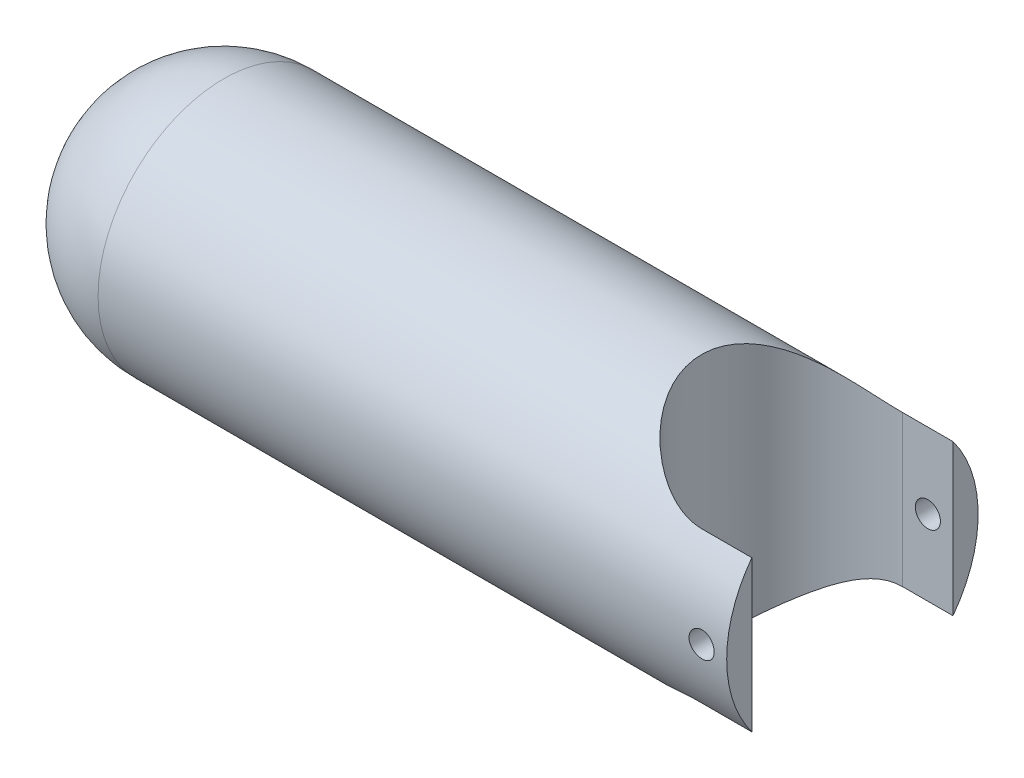
from build123d import *

# Parameters (mm, degrees)
CORTAR_EXTRUIR1_DEPTH      = 166.73304219
CORTAR_EXTRUIR1_DEPTH_BACK = 166.73304219
CROQUIS6_R                 = 2.5
CORTAR_EXTRUIR3_DEPTH      = 166.733042318
CORTAR_EXTRUIR3_DEPTH_BACK = 166.733042318


with BuildPart() as part:
    # Croquis3 → Revolución10 (revolve)
    with BuildSketch(Plane(origin=(0, 0, 0), x_dir=(1, 0, 0), z_dir=(0, 1, 0))):
        with BuildLine():
            Line((11.918007873, 0), (161.918007873, 0))
            Line((161.918007873, 0), (161.918007873, 25))
            Line((161.918007873, 25), (36.918007873, 25))
            ThreePointArc((36.918007873, 25), (19.240338344, 17.67766953), (11.918007873, 0))
        make_face()
    revolve(axis=Axis((11.918007873, 0, 0), (1, 0, 0)))

    # Croquis6 → Cortar-Extruir1 (cut, two sides: drawn at the far end of the back side and taken through both)
    with BuildSketch(Plane.XY.offset(-CORTAR_EXTRUIR1_DEPTH_BACK)):
        with Locations((156.918007873, 0)):
            Circle(CROQUIS6_R)
    extrude(amount=CORTAR_EXTRUIR1_DEPTH + CORTAR_EXTRUIR1_DEPTH_BACK, mode=Mode.SUBTRACT)

    # Croquis9 → Cortar-Extruir3 (cut, two sides: drawn at the far end of the back side and taken through both)
    with BuildSketch(Plane(origin=(0, 0, 0), x_dir=(1, 0, 0), z_dir=(0, 1, 0)).offset(-CORTAR_EXTRUIR3_DEPTH_BACK)):
        with BuildLine():
            Line((161.918007873, 20), (161.918007873, -20))
            Line((161.918007873, -20), (151.918007873, -20))
            ThreePointArc((151.918007873, -20), (131.918007873, 0), (151.918007873, 20))
            Line((151.918007873, 20), (161.918007873, 20))
        make_face()
    extrude(amount=CORTAR_EXTRUIR3_DEPTH + CORTAR_EXTRUIR3_DEPTH_BACK, mode=Mode.SUBTRACT)


solid = part.part
